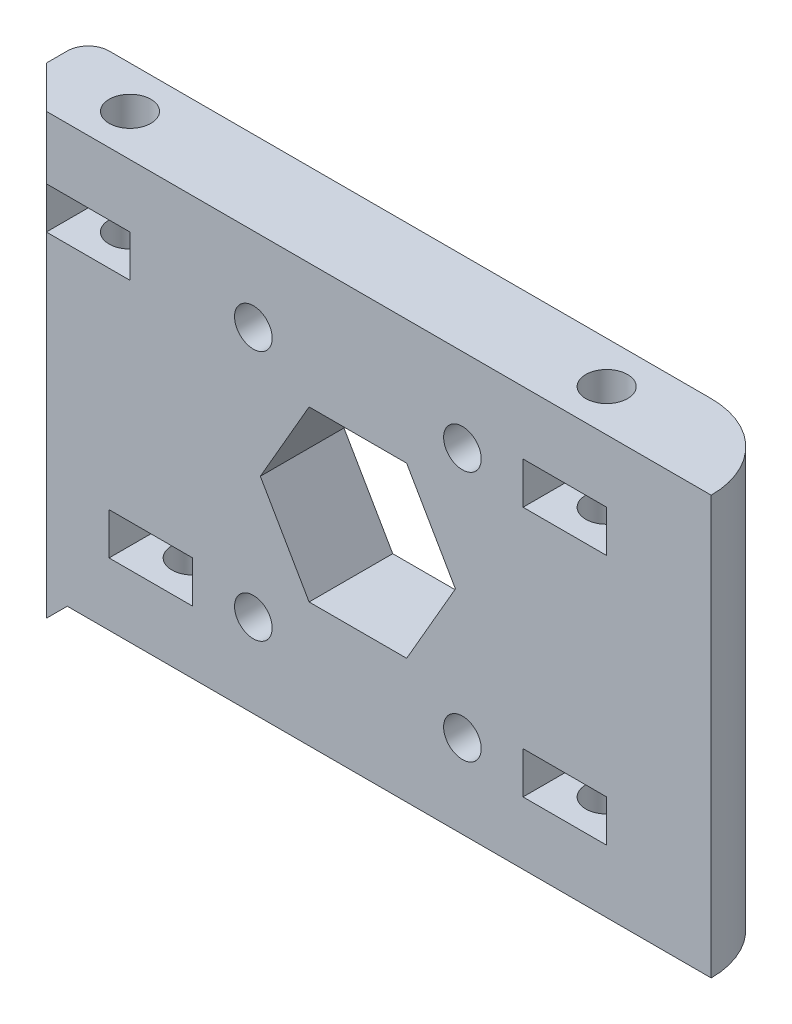
from build123d import *

# Parameters (mm, degrees)
SKETCH1_W           = 4
SKETCH1_H           = 2
SKETCH1_R           = 0.9
BOSS_EXTRUDE1_DEPTH = 4
SKETCH3_R           = 1
CUT_EXTRUDE1_DEPTH  = 20
SKETCH3_3_R         = 1
CUT_EXTRUDE2_DEPTH  = 10
SKETCH5_R           = 1
CUT_EXTRUDE3_DEPTH  = 10
CHAMFER2_SIZE       = 2
FILLET2_R           = 1
FILLET3_R           = 4
SKETCH6_W           = 35.460431149
SKETCH6_H           = 4.319546663
CUT_EXTRUDE4_DEPTH  = 29


with BuildPart() as part:
    # Sketch1 → Boss-Extrude1 (new body)
    # profile 1 of 2: a face of its own
    with BuildSketch(Plane.XY):
        Polygon((-9.335901083, -15.296943817), (-6.335901083, -15.296943817), (24.464098917, -15.296943817), (24.464098917, 4.703056183), (-9.335901083, 4.703056183), align=None)
        with Locations((-2.335901083, -11.296943817)):
            Rectangle(SKETCH1_W, SKETCH1_H, mode=Mode.SUBTRACT)
        with Locations((2.564098917, -11.296943817)):
            Circle(SKETCH1_R, mode=Mode.SUBTRACT)
        with Locations((12.564098917, -11.296943817)):
            Circle(SKETCH1_R, mode=Mode.SUBTRACT)
        with Locations((17.464098917, -11.296943817)):
            Rectangle(SKETCH1_W, SKETCH1_H, mode=Mode.SUBTRACT)
        with Locations((-5.335901083, 0.703056183)):
            Rectangle(SKETCH1_W, SKETCH1_H, mode=Mode.SUBTRACT)
        with Locations((2.564098917, 0.703056183)):
            Circle(SKETCH1_R, mode=Mode.SUBTRACT)
        Polygon((9.896924586, -1.256371234), (12.229750255, -5.296943817), (9.896924586, -9.337516401), (5.231273248, -9.337516401), (2.898447579, -5.296943817), (5.231273248, -1.256371234), align=None, mode=Mode.SUBTRACT)
        with Locations((12.564098917, 0.703056183)):
            Circle(SKETCH1_R, mode=Mode.SUBTRACT)
        with Locations((17.464098917, 0.703056183)):
            Rectangle(SKETCH1_W, SKETCH1_H, mode=Mode.SUBTRACT)
    # profile 2 of 2: a face of its own
    with BuildSketch(Plane.XY):
        Polygon((-9.335901083, -15.296943817), (-9.335901083, -18.296943817), (-6.335901083, -15.296943817), align=None)
    extrude(amount=BOSS_EXTRUDE1_DEPTH)

    # Sketch3 → Cut-Extrude1 (cut)
    with BuildSketch(Plane.XZ.offset(15.296943817)):
        with Locations((17.464098917, 2)):
            Circle(SKETCH3_R)
    extrude(amount=-CUT_EXTRUDE1_DEPTH, mode=Mode.SUBTRACT)

    # Sketch3<3> → Cut-Extrude2 (cut)
    with BuildSketch(Plane.XZ.offset(15.296943817)):
        with Locations((-2.335901083, 2)):
            Circle(SKETCH3_3_R)
    extrude(amount=-CUT_EXTRUDE2_DEPTH, mode=Mode.SUBTRACT)

    # Sketch5 → Cut-Extrude3 (cut)
    with BuildSketch(Plane(origin=(0, 4.703056183, 0), x_dir=(1, 0, 0), z_dir=(0, 1, 0))):
        with Locations(Location((-5.335901083, -2, 0), (0, 0, 180))):
            Circle(SKETCH5_R)
    extrude(amount=-CUT_EXTRUDE3_DEPTH, mode=Mode.SUBTRACT)

    # Chamfer2
    chamfer2_edges = [part.edges().sort_by_distance(p)[0] for p in [
        (-9.335901083, -6.796943817, 0),
    ]]
    chamfer(chamfer2_edges, length=CHAMFER2_SIZE - 0.0001)  # a hair under: the kernel refuses the full size

    # Fillet2
    fillet2_edges = [part.edges().sort_by_distance(p)[0] for p in [
        (-9.335901083, -6.796943817, 4),
    ]]
    fillet(fillet2_edges, radius=FILLET2_R)

    # Fillet3
    fillet3_edges = [part.edges().sort_by_distance(p)[0] for p in [
        (24.464098917, -5.296943817, 4),
    ]]
    fillet(fillet3_edges, radius=FILLET3_R - 0.0001)  # a hair under: the kernel refuses the full size


with BuildPart() as body_2:
    # Mirror1: mirrored copy
    add(part.part.mirror(Plane.XY))


with BuildPart() as part_1:
    add(part.part)

    # Sketch6 → Cut-Extrude4 (cut)
    with BuildSketch(Plane(origin=(0, 4.703056183, 0), x_dir=(1, 0, 0), z_dir=(0, 1, 0))):
        with Locations((6.733883343, -2.159773332)):
            Rectangle(SKETCH6_W, SKETCH6_H)
    extrude(amount=-CUT_EXTRUDE4_DEPTH, mode=Mode.SUBTRACT)


solid = body_2.part
